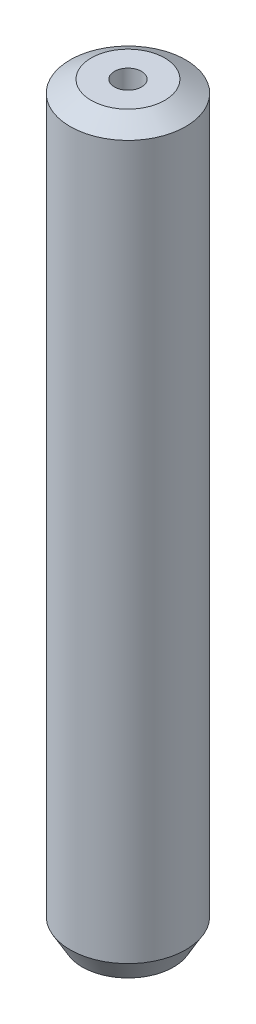
from build123d import *
from OCP.BRepFilletAPI import BRepFilletAPI_MakeChamfer

# Parameters (mm, degrees)
SKETCH1_R           = 7.5
BOSS_EXTRUDE1_DEPTH = 96.799986058
SKETCH2_R           = 1.758437327
CUT_EXTRUDE1_DEPTH  = 98.379347404
CHAMFER1_SIZE       = 1.576577124
CHAMFER1_SIZE2      = 2.730711681


with BuildPart() as part:
    # Sketch1 → Boss-Extrude1 (new body)
    with BuildSketch(Plane(origin=(0, 0, 0), x_dir=(1, 0, 0), z_dir=(0, 1, 0))):
        Circle(SKETCH1_R)
    extrude(amount=BOSS_EXTRUDE1_DEPTH)

    # Sketch2 → Cut-Extrude1 (cut, through all)
    with BuildSketch(Plane(origin=(0, 0, 0), x_dir=(1, 0, 0), z_dir=(0, 1, 0))):
        Circle(SKETCH2_R)
    extrude(amount=CUT_EXTRUDE1_DEPTH, mode=Mode.SUBTRACT)

    # Chamfer1: one chamfer whose edges measure the first distance from different faces: ONE call of the kernel's chamfer builder (chamfer() names one face for all edges)
    chamfer1_edges_1 = [part.edges().sort_by_distance(p)[0] for p in [
        (-7.5, 96.799986058, 0),
    ]]
    chamfer1_side_1 = [part.faces().sort_by_distance(p)[0] for p in [
        (-7.5, 48.399993029, 0),
    ]]
    chamfer1_edges_2 = [part.edges().sort_by_distance(p)[0] for p in [
        (-7.5, 0, 0),
    ]]
    chamfer1_side_2 = [part.faces().sort_by_distance(p)[0] for p in [
        (-7.287867966, 0, 0),
    ]]
    chamfer1 = BRepFilletAPI_MakeChamfer(part.part.solid().wrapped)
    for e in chamfer1_edges_1:
        chamfer1.Add(CHAMFER1_SIZE, CHAMFER1_SIZE2, e.wrapped, chamfer1_side_1[0].wrapped)  # the first distance lies on this face
    for e in chamfer1_edges_2:
        chamfer1.Add(CHAMFER1_SIZE, CHAMFER1_SIZE2, e.wrapped, chamfer1_side_2[0].wrapped)  # the first distance lies on this face
    add(Compound.cast(chamfer1.Shape()), mode=Mode.REPLACE)


solid = part.part
